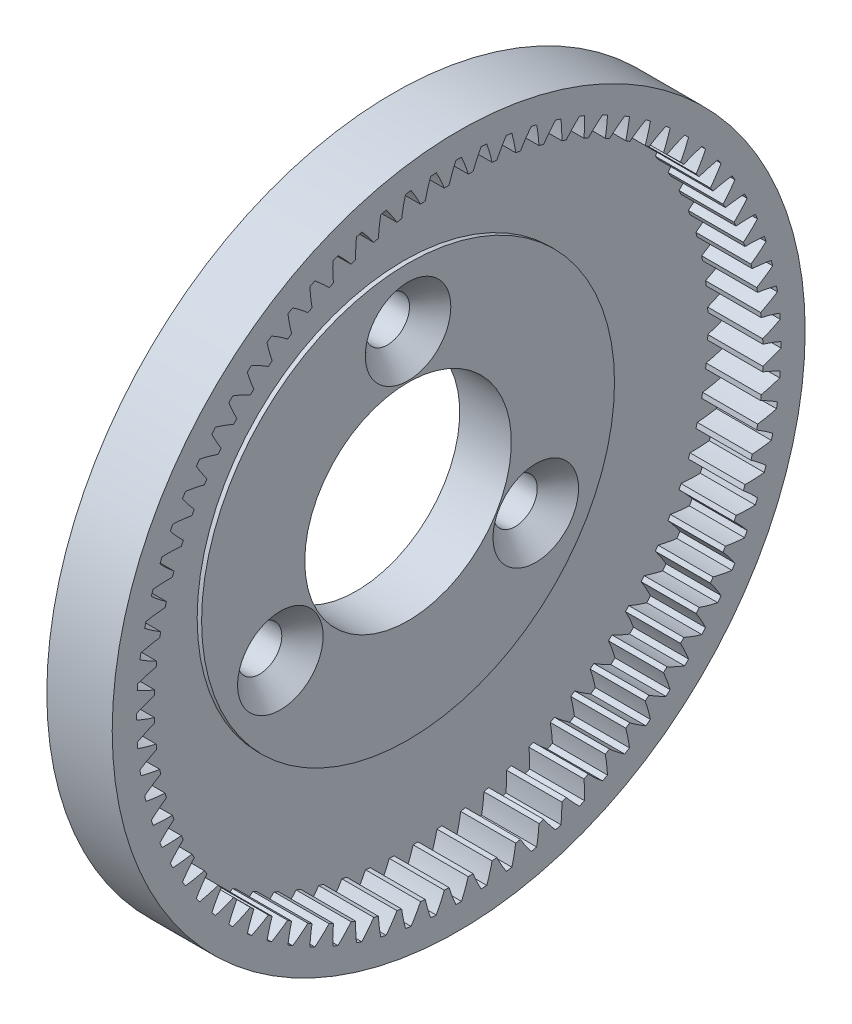
from build123d import *

# Parameters (mm, degrees)
BASPROSKE_W              = 3.7338
BASPROSKE_H              = 2.8575
TOOTHCUT_DEPTH           = 34.436078006
TEETHCUTS_COUNT          = 80
TEETHCUTS_ANGLE          = 355.5
ESBO_O1_R                = 23.495
RESSALTO_EXTRUS_O1_DEPTH = 3.2
CORTE_EXTRUS_O1_REACH    = 35.943
ESBO_O2_R                = 7.005
ESBO_O2_R_2              = 1.5
CHANFRO1_SIZE            = 2.50000008
CHANFRO1_SIZE2           = 4.330127157
ESBO_O3_R                = 14
ESBO_O3_R_2              = 7.005
ESBO_O3_R_3              = 1.5
RESSALTO_EXTRUS_O2_DEPTH = 0.3
CHANFRO2_SIZE            = 1.4


with BuildPart() as part:
    # BasProSke → Base-Revolve (revolve)
    with BuildSketch(Plane(origin=(0, 0, 0), x_dir=(1, 0, 0), z_dir=(0, 1, 0)), mode=Mode.PRIVATE) as base_revolve_sk:
        with Locations((1.8669, 22.06625)):
            Rectangle(BASPROSKE_W, BASPROSKE_H)
    revolve(base_revolve_sk.sketch.rotate(Axis((-10, 0, 0), (1, 0, 0)), 180), axis=Axis((-10, 0, 0), (1, 0, 0)))

    # TooCutSke → ToothCut (cut, through all)
    with BuildSketch(Plane(origin=(0, 0, 0), x_dir=(0, 0, -1), z_dir=(1, 0, 0))):
        with BuildLine():
            ThreePointArc((0.655112883, 20.601686667), (0.442228944, 21.233999124), (0.189926035, 21.8516413))
            ThreePointArc((0.189926035, 21.8516413), (0, 21.852466667), (-0.189926035, 21.8516413))
            ThreePointArc((-0.189926035, 21.8516413), (-0.442228944, 21.233999124), (-0.655112883, 20.601686667))
            ThreePointArc((-0.655112883, 20.601686667), (0, 20.6121), (0.655112883, 20.601686667))
        make_face()
    toothcut = extrude(amount=TOOTHCUT_DEPTH, mode=Mode.SUBTRACT)

    # TeethCuts: ToothCut ×80 about axis
    teethcuts_axis = Axis((-10, 0, 0), (1, 0, 0))
    for i in range(1, TEETHCUTS_COUNT):
        add(toothcut.rotate(teethcuts_axis, i * TEETHCUTS_ANGLE / (TEETHCUTS_COUNT - 1)), mode=Mode.SUBTRACT)

    # Esboço1 → Ressalto-extrusão1 (add)
    with BuildSketch(Plane.ZY):
        Circle(ESBO_O1_R)
    extrude(amount=RESSALTO_EXTRUS_O1_DEPTH)

    # Esboço2 → Corte-extrusão1 (cut, up to next)
    with BuildSketch(Plane.ZY.offset(3.2), mode=Mode.PRIVATE) as corte_extrus_o1_sk1:
        Circle(ESBO_O2_R)
    corte_extrus_o1_tool1 = extrude(corte_extrus_o1_sk1.sketch, amount=-CORTE_EXTRUS_O1_REACH, mode=Mode.PRIVATE) & part.part
    # Esboço2 → Corte-extrusão1 (cut, up to next)
    with BuildSketch(Plane.ZY.offset(3.2), mode=Mode.PRIVATE) as corte_extrus_o1_sk2:
        with Locations((0, 10)):
            Circle(ESBO_O2_R_2)
    corte_extrus_o1_tool2 = extrude(corte_extrus_o1_sk2.sketch, amount=-CORTE_EXTRUS_O1_REACH, mode=Mode.PRIVATE) & part.part
    # Esboço2 → Corte-extrusão1 (cut, up to next)
    with BuildSketch(Plane.ZY.offset(3.2), mode=Mode.PRIVATE) as corte_extrus_o1_sk3:
        with Locations((-8.660254038, -5)):
            Circle(ESBO_O2_R_2)
    corte_extrus_o1_tool3 = extrude(corte_extrus_o1_sk3.sketch, amount=-CORTE_EXTRUS_O1_REACH, mode=Mode.PRIVATE) & part.part
    # Esboço2 → Corte-extrusão1 (cut, up to next)
    with BuildSketch(Plane.ZY.offset(3.2), mode=Mode.PRIVATE) as corte_extrus_o1_sk4:
        with Locations((8.660254038, -5)):
            Circle(ESBO_O2_R_2)
    corte_extrus_o1_tool4 = extrude(corte_extrus_o1_sk4.sketch, amount=-CORTE_EXTRUS_O1_REACH, mode=Mode.PRIVATE) & part.part
    add(corte_extrus_o1_tool1.solids().sort_by_distance((-3.2, 0, 0))[0], mode=Mode.SUBTRACT)
    add(corte_extrus_o1_tool2.solids().sort_by_distance((-3.2, 10, 0))[0], mode=Mode.SUBTRACT)
    add(corte_extrus_o1_tool3.solids().sort_by_distance((-3.2, -5, -8.660254))[0], mode=Mode.SUBTRACT)
    add(corte_extrus_o1_tool4.solids().sort_by_distance((-3.2, -5, 8.660254))[0], mode=Mode.SUBTRACT)

    # Chanfro1
    chanfro1_edges = [part.edges().sort_by_distance(p)[0] for p in [
        (-3.2, 0, -23.495),
    ]]
    chanfro1_side = [part.faces().sort_by_distance(p)[0] for p in [
        (0.2669, 0, -23.495),
    ]]
    chamfer(chanfro1_edges, length=CHANFRO1_SIZE, length2=CHANFRO1_SIZE2, reference=chanfro1_side[0])

    # Esboço3 → Ressalto-extrusão2 (add)
    with BuildSketch(Plane(origin=(0, 0, 0), x_dir=(0, 0, -1), z_dir=(1, 0, 0))):
        with Locations(Location((0, 0, 0), (0, 0, 180))):
            Circle(ESBO_O3_R)
        with Locations(Location((0, 0, 0), (0, 0, 180))):
            Circle(ESBO_O3_R_2, mode=Mode.SUBTRACT)
        with Locations(Location((-8.660254038, -5, 0), (0, 0, 180))):
            Circle(ESBO_O3_R_3, mode=Mode.SUBTRACT)
        with Locations(Location((8.660254038, -5, 0), (0, 0, 180))):
            Circle(ESBO_O3_R_3, mode=Mode.SUBTRACT)
        with Locations(Location((0, 10, 0), (0, 0, 180))):
            Circle(ESBO_O3_R_3, mode=Mode.SUBTRACT)
    extrude(amount=RESSALTO_EXTRUS_O2_DEPTH)

    # Chanfro2
    chanfro2_edges = [part.edges().sort_by_distance(p)[0] for p in [
        (0.3, -5, 7.160254038),
        (0.3, -5, -10.160254038),
        (0.3, 10, -1.5),
    ]]
    chamfer(chanfro2_edges, length=CHANFRO2_SIZE)


solid = part.part
